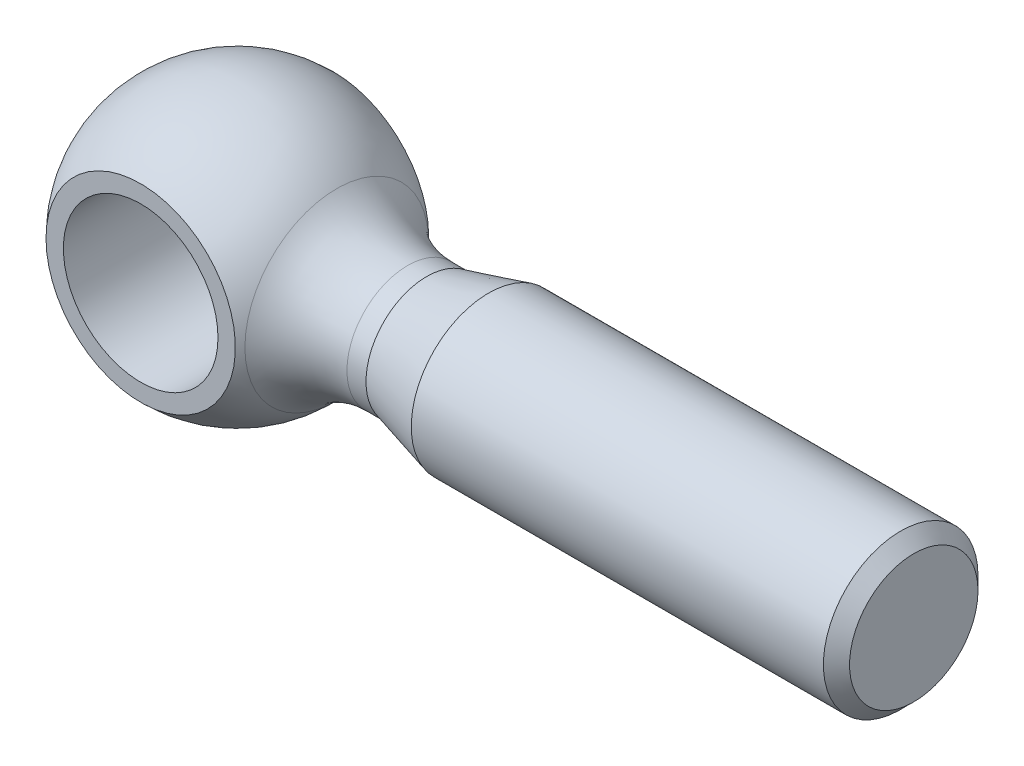
from build123d import *

# Parameters (mm, degrees)
SKETCH2_R               = 4
BASEBODY_DEPTH          = 35
CUT_EXTRUDE1_DEPTH      = 37.373066959
CUT_EXTRUDE1_DEPTH_BACK = 37.373066959
SKETCH4_R               = 4
HOLE_DEPTH              = 38.067505987
CHAMFER1_SIZE           = 0.6765
HEADFILLET_R            = 5


with BuildPart() as part:
    # Sketch2 → BaseBody (new body)
    with BuildSketch(Plane(origin=(0, 0, 0), x_dir=(0, 0, -1), z_dir=(1, 0, 0))):
        Circle(SKETCH2_R)
    extrude(amount=BASEBODY_DEPTH)

    # Sketch5 → Cut-Revolve1 (revolve, cut)
    with BuildSketch(Plane.XY):
        Polygon((0, 3.142562584), (9.8, 3.142562584), (13, 4), (0, 4), align=None)
    revolve(axis=Axis((35, 0, 0), (-1, 0, 0)), mode=Mode.SUBTRACT)

    # Sketch1 → BaseHead (revolve)
    with BuildSketch(Plane(origin=(0.956717866, 0, -6.043282134), x_dir=(0, 0, -1), z_dir=(0, 1, 0))):
        with BuildLine():
            Line((-13.043282134, 0.956717866), (0.956717866, 0.956717866))
            ThreePointArc((0.956717866, 0.956717866), (-6.043282134, 7.956717866), (-13.043282134, 0.956717866))
        make_face()
    revolve(axis=Axis((0, 0, 13.34823651), (0, 0, -1)))

    # Sketch3 → Cut-Extrude1 (cut, two sides: drawn at the far end of the back side and taken through both)
    with BuildSketch(Plane(origin=(0, 0, 0), x_dir=(0, 0, -1), z_dir=(1, 0, 0)).offset(-CUT_EXTRUDE1_DEPTH_BACK)):
        with BuildLine():
            Line((-5, 4.898979486), (-5, -4.898979486))
            ThreePointArc((-5, -4.898979486), (-7, 0), (-5, 4.898979486))
        make_face()
        with BuildLine():
            Line((5, 4.898979486), (5, -4.898979486))
            ThreePointArc((5, -4.898979486), (7, 0), (5, 4.898979486))
        make_face()
    extrude(amount=CUT_EXTRUDE1_DEPTH + CUT_EXTRUDE1_DEPTH_BACK, mode=Mode.SUBTRACT)

    # Sketch4 → Hole (cut, through all)
    with BuildSketch(Plane.XY.offset(5)):
        Circle(SKETCH4_R)
    extrude(amount=-HOLE_DEPTH, mode=Mode.SUBTRACT)

    # Chamfer1
    chamfer1_edges = [part.edges().sort_by_distance(p)[0] for p in [
        (35, 0, 4),
    ]]
    chamfer(chamfer1_edges, length=CHAMFER1_SIZE)

    # HeadFillet
    headfillet_edges = [part.edges().sort_by_distance(p)[0] for p in [
        (6.254942078, -3.142562584, 0),
    ]]
    fillet(headfillet_edges, radius=HEADFILLET_R)


solid = part.part
